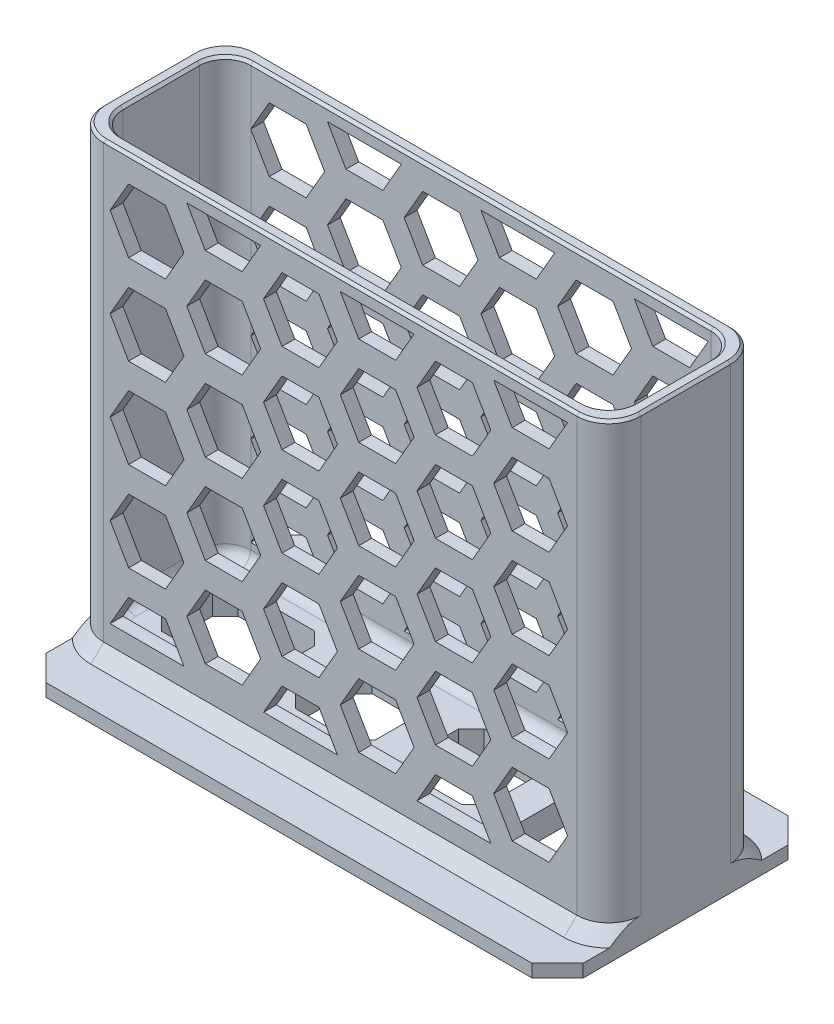
from build123d import *

# Parameters (mm, degrees)
SKETCH1_W           = 210
SKETCH1_H           = 60
BOSS_EXTRUDE1_DEPTH = 5
SKETCH2_W           = 210
SKETCH2_H           = 60
SKETCH2_W_2         = 200
SKETCH2_H_2         = 50
BOSS_EXTRUDE2_DEPTH = 170
FILLET1_R           = 10
FILLET2_R           = 12.5
FILLET3_R           = 5
CUT_EXTRUDE1_DEPTH  = 170
SKETCH4_W           = 210
SKETCH4_H           = 100
BOSS_EXTRUDE3_DEPTH = 5
CHAMFER1_SIZE       = 5
CHAMFER2_SIZE       = 10
CHAMFER3_SIZE       = 1
SKETCH5_W           = 40
SKETCH5_H           = 30
SKETCH5_W_2         = 31.25
CUT_EXTRUDE2_DEPTH  = 10
CHAMFER4_SIZE       = 5


with BuildPart() as part:
    # Sketch1 → Boss-Extrude1 (new body)
    with BuildSketch(Plane(origin=(0, 0, 0), x_dir=(1, 0, 0), z_dir=(0, 1, 0))):
        Rectangle(SKETCH1_W, SKETCH1_H)
    extrude(amount=BOSS_EXTRUDE1_DEPTH)

    # Sketch2 → Boss-Extrude2 (add)
    with BuildSketch(Plane(origin=(0, 5, 0), x_dir=(1, 0, 0), z_dir=(0, 1, 0))):
        Rectangle(SKETCH2_W, SKETCH2_H)
        Rectangle(SKETCH2_W_2, SKETCH2_H_2, mode=Mode.SUBTRACT)
    extrude(amount=BOSS_EXTRUDE2_DEPTH)

    # Fillet1
    fillet1_edges = [part.edges().sort_by_distance(p)[0] for p in [
        (100, 90, -25),
        (-100, 90, -25),
        (-100, 90, 25),
        (100, 90, 25),
    ]]
    fillet(fillet1_edges, radius=FILLET1_R)

    # Fillet2
    fillet2_edges = [part.edges().sort_by_distance(p)[0] for p in [
        (105, 87.5, 30),
        (-105, 87.5, 30),
        (-105, 87.5, -30),
        (105, 87.5, -30),
    ]]
    fillet(fillet2_edges, radius=FILLET2_R)

    # Fillet3
    fillet3_edges = [part.edges().sort_by_distance(p)[0] for p in [
        (0, 5, 25),
        (100, 5, 0),
        (0, 5, -25),
        (-100, 5, 0),
        (-97.071067812, 5, -22.071067812),
        (97.071067812, 5, -22.071067812),
        (-97.071067812, 5, 22.071067812),
        (97.071067812, 5, 22.071067812),
    ]]
    fillet(fillet3_edges, radius=FILLET3_R)

    # Sketch3 → Cut-Extrude1 (cut)
    with BuildSketch(Plane.XY.offset(30)):
        Polygon((-61.132486541, 117.5), (-68.349364905, 130), (-82.783121635, 130), (-90, 117.5), (-82.783121635, 105), (-68.349364905, 105), align=None)
        Polygon((-61.132486541, 152.5), (-68.349364905, 165), (-82.783121635, 165), (-90, 152.5), (-82.783121635, 140), (-68.349364905, 140), align=None)
        Polygon((-61.132486541, 82.5), (-68.349364905, 95), (-82.783121635, 95), (-90, 82.5), (-82.783121635, 70), (-68.349364905, 70), align=None)
        Polygon((-61.132486541, 47.5), (-68.349364905, 60), (-82.783121635, 60), (-90, 47.5), (-82.783121635, 35), (-68.349364905, 35), align=None)
        Polygon((-61.132486541, 12.5), (-68.349364905, 25), (-82.783121635, 25), (-90, 12.5), align=None)
        Polygon((0, 170), (28.867513459, 170), (21.650635095, 157.5), (7.216878365, 157.5), align=None)
        Polygon((60, 170), (88.867513459, 170), (81.650635095, 157.5), (67.216878365, 157.5), align=None)
        Polygon((-38.349364905, 157.5), (-31.132486541, 170), (-60, 170), (-52.783121635, 157.5), align=None)
        Polygon((-52.783121635, 147.5), (-60, 135), (-52.783121635, 122.5), (-38.349364905, 122.5), (-31.132486541, 135), (-38.349364905, 147.5), align=None)
        Polygon((-31.132486541, 100), (-38.349364905, 112.5), (-52.783121635, 112.5), (-60, 100), (-52.783121635, 87.5), (-38.349364905, 87.5), align=None)
        Polygon((-38.349364905, 77.5), (-52.783121635, 77.5), (-60, 65), (-52.783121635, 52.5), (-38.349364905, 52.5), (-31.132486541, 65), align=None)
        Polygon((-38.349364905, 17.5), (-31.132486541, 30), (-38.349364905, 42.5), (-52.783121635, 42.5), (-60, 30), (-52.783121635, 17.5), align=None)
        Polygon((-1.132486541, 117.5), (-8.349364905, 130), (-22.783121635, 130), (-30, 117.5), (-22.783121635, 105), (-8.349364905, 105), align=None)
        Polygon((-1.132486541, 152.5), (-8.349364905, 165), (-22.783121635, 165), (-30, 152.5), (-22.783121635, 140), (-8.349364905, 140), align=None)
        Polygon((-1.132486541, 82.5), (-8.349364905, 95), (-22.783121635, 95), (-30, 82.5), (-22.783121635, 70), (-8.349364905, 70), align=None)
        Polygon((-1.132486541, 47.5), (-8.349364905, 60), (-22.783121635, 60), (-30, 47.5), (-22.783121635, 35), (-8.349364905, 35), align=None)
        Polygon((-1.132486541, 12.5), (-8.349364905, 25), (-22.783121635, 25), (-30, 12.5), align=None)
        Polygon((7.216878365, 147.5), (0, 135), (7.216878365, 122.5), (21.650635095, 122.5), (28.867513459, 135), (21.650635095, 147.5), align=None)
        Polygon((28.867513459, 100), (21.650635095, 112.5), (7.216878365, 112.5), (0, 100), (7.216878365, 87.5), (21.650635095, 87.5), align=None)
        Polygon((21.650635095, 77.5), (7.216878365, 77.5), (0, 65), (7.216878365, 52.5), (21.650635095, 52.5), (28.867513459, 65), align=None)
        Polygon((21.650635095, 17.5), (28.867513459, 30), (21.650635095, 42.5), (7.216878365, 42.5), (0, 30), (7.216878365, 17.5), align=None)
        Polygon((58.867513459, 117.5), (51.650635095, 130), (37.216878365, 130), (30, 117.5), (37.216878365, 105), (51.650635095, 105), align=None)
        Polygon((58.867513459, 152.5), (51.650635095, 165), (37.216878365, 165), (30, 152.5), (37.216878365, 140), (51.650635095, 140), align=None)
        Polygon((58.867513459, 82.5), (51.650635095, 95), (37.216878365, 95), (30, 82.5), (37.216878365, 70), (51.650635095, 70), align=None)
        Polygon((58.867513459, 47.5), (51.650635095, 60), (37.216878365, 60), (30, 47.5), (37.216878365, 35), (51.650635095, 35), align=None)
        Polygon((58.867513459, 12.5), (51.650635095, 25), (37.216878365, 25), (30, 12.5), align=None)
        Polygon((67.216878365, 147.5), (60, 135), (67.216878365, 122.5), (81.650635095, 122.5), (88.867513459, 135), (81.650635095, 147.5), align=None)
        Polygon((88.867513459, 100), (81.650635095, 112.5), (67.216878365, 112.5), (60, 100), (67.216878365, 87.5), (81.650635095, 87.5), align=None)
        Polygon((81.650635095, 77.5), (67.216878365, 77.5), (60, 65), (67.216878365, 52.5), (81.650635095, 52.5), (88.867513459, 65), align=None)
        Polygon((81.650635095, 17.5), (88.867513459, 30), (81.650635095, 42.5), (67.216878365, 42.5), (60, 30), (67.216878365, 17.5), align=None)
    extrude(amount=-CUT_EXTRUDE1_DEPTH, mode=Mode.SUBTRACT)

    # Sketch4 → Boss-Extrude3 (add)
    with BuildSketch(Plane.XZ):
        Rectangle(SKETCH4_W, SKETCH4_H)
    extrude(amount=BOSS_EXTRUDE3_DEPTH)

    # Chamfer1
    # the kernel refuses this chamfer: 5 mm, written as the material it adds along each edge
    with BuildSketch(Plane(origin=(92.5, 0, 30), x_dir=(0, -0.02749587661058634, 0.9996219169112968), z_dir=(-1, 0, 0)), Plane(origin=(-92.5, 0, -30), x_dir=(0, -0.027495876610586403, -0.9996219169112968), z_dir=(1, 0, 0))) as chamfer1_piece_1:
        Polygon((CHAMFER1_SIZE * 0.999621916911, CHAMFER1_SIZE * 0.0274958766106), (-CHAMFER1_SIZE * 0.0274958766106, CHAMFER1_SIZE * 0.999621916911), (0, 0), align=None)
    extrude(amount=185)
    with BuildSketch(Plane(origin=(-92.5, 0, -17.5), x_dir=(0, 0, -1), z_dir=(1, 0, 0))) as chamfer1_piece_2_section:
        Polygon((12.5 + CHAMFER1_SIZE, 0), (12.5, CHAMFER1_SIZE), (12.5, 0), align=None)
    chamfer1_piece_2 = revolve(axis=Axis((-92.5, 0, -17.5), (0, 1, 0)), revolution_arc=148.962308712, mode=Mode.PRIVATE)
    chamfer1_piece_2 = split(chamfer1_piece_2, bisect_by=Plane(origin=(-105, 1.401901071, -31.454896581), z_dir=(1, 0, 0)), keep=Keep.TOP, mode=Mode.PRIVATE)
    add(chamfer1_piece_2)
    with BuildSketch(Plane(origin=(-92.5, 0, 17.5), x_dir=(0, 0, 1), z_dir=(1, 0, 0))) as chamfer1_piece_3_section:
        Polygon((12.5 + CHAMFER1_SIZE, 0), (12.5, -CHAMFER1_SIZE), (12.5, 0), align=None)
    chamfer1_piece_3 = revolve(axis=Axis((-92.5, 0, 17.5), (0, -1, 0)), revolution_arc=148.962308712, mode=Mode.PRIVATE)
    chamfer1_piece_3 = split(chamfer1_piece_3, bisect_by=Plane(origin=(-105, 1.401901071, 31.454896581), z_dir=(1, 0, 0)), keep=Keep.TOP, mode=Mode.PRIVATE)
    add(chamfer1_piece_3)
    with BuildSketch(Plane(origin=(92.5, 0, -17.5), x_dir=(0.5156018398614218, 0, 0.8568283041143755), z_dir=(-0.8568283041143755, 0, 0.5156018398614218))) as chamfer1_piece_4_section:
        Polygon((12.5 + CHAMFER1_SIZE, 0), (12.5, CHAMFER1_SIZE), (12.5, 0), align=None)
    chamfer1_piece_4 = revolve(axis=Axis((92.5, 0, -17.5), (0, 1, 0)), revolution_arc=148.962308712, mode=Mode.PRIVATE)
    chamfer1_piece_4 = split(chamfer1_piece_4, bisect_by=Plane(origin=(105, 1.924043462, -26.849940112), z_dir=(-1, 0, 0)), keep=Keep.TOP, mode=Mode.PRIVATE)
    add(chamfer1_piece_4)
    with BuildSketch(Plane(origin=(92.5, 0, 17.5), x_dir=(0, 0, 1), z_dir=(-1, 0, 0))) as chamfer1_piece_5_section:
        Polygon((12.5 + CHAMFER1_SIZE, 0), (12.5, CHAMFER1_SIZE), (12.5, 0), align=None)
    chamfer1_piece_5 = revolve(axis=Axis((92.5, 0, 17.5), (0, 1, 0)), revolution_arc=148.962308712, mode=Mode.PRIVATE)
    chamfer1_piece_5 = split(chamfer1_piece_5, bisect_by=Plane(origin=(105, 1.401901071, 31.454896581), z_dir=(-1, 0, 0)), keep=Keep.TOP, mode=Mode.PRIVATE)
    add(chamfer1_piece_5)

    # Chamfer2
    chamfer2_edges = [part.edges().sort_by_distance(p)[0] for p in [
        (105, -2.5, -50),
        (105, -2.5, 50),
        (-105, -2.5, 50),
        (-105, -2.5, -50),
    ]]
    chamfer(chamfer2_edges, length=CHAMFER2_SIZE)

    # Chamfer3
    chamfer3_edges = [part.edges().sort_by_distance(p)[0] for p in [
        (0, 175, 25),
        (100, 175, 0),
        (-100, 175, 0),
        (0, 175, -25),
        (97.071067812, 175, 22.071067812),
        (-97.071067812, 175, 22.071067812),
        (97.071067812, 175, -22.071067812),
        (-97.071067812, 175, -22.071067812),
        (105, 175, 0),
        (0, 175, 30),
        (0, 175, -30),
        (-105, 175, 0),
        (-101.338834765, 175, -26.338834765),
        (-101.338834765, 175, 26.338834765),
        (101.338834765, 175, -26.338834765),
        (101.338834765, 175, 26.338834765),
    ]]
    chamfer(chamfer3_edges, length=CHAMFER3_SIZE)

    # Sketch5 → Cut-Extrude2 (cut)
    with BuildSketch(Plane(origin=(0, 5, 0), x_dir=(1, 0, 0), z_dir=(0, 1, 0))):
        with Locations((-70, 0)):
            Rectangle(SKETCH5_W, SKETCH5_H)
        Polygon((90, -15), (90, 15), (50, 15), (50, 0), (50, -15), align=None)
        Polygon((6.25, 1.240594722), (6.25, 15), (37.5, 15), (37.5, 0), (37.5, -15), (6.25, -15), align=None)
        with Locations((-21.875, 0)):
            Rectangle(SKETCH5_W_2, SKETCH5_H)
    extrude(amount=-CUT_EXTRUDE2_DEPTH, mode=Mode.SUBTRACT)

    # Chamfer4
    chamfer4_edges = [part.edges().sort_by_distance(p)[0] for p in [
        (50, 0, -15),
        (90, 0, -15),
        (90, 0, 15),
        (50, 0, 15),
        (-6.25, 0, 15),
        (-37.5, 0, 15),
        (-37.5, 0, -15),
        (-6.25, 0, -15),
        (37.5, 0, -15),
        (37.5, 0, 15),
        (6.25, 0, 15),
        (6.25, 0, -15),
        (-50, 0, 15),
        (-90, 0, 15),
        (-90, 0, -15),
        (-50, 0, -15),
    ]]
    chamfer(chamfer4_edges, length=CHAMFER4_SIZE)


solid = part.part
